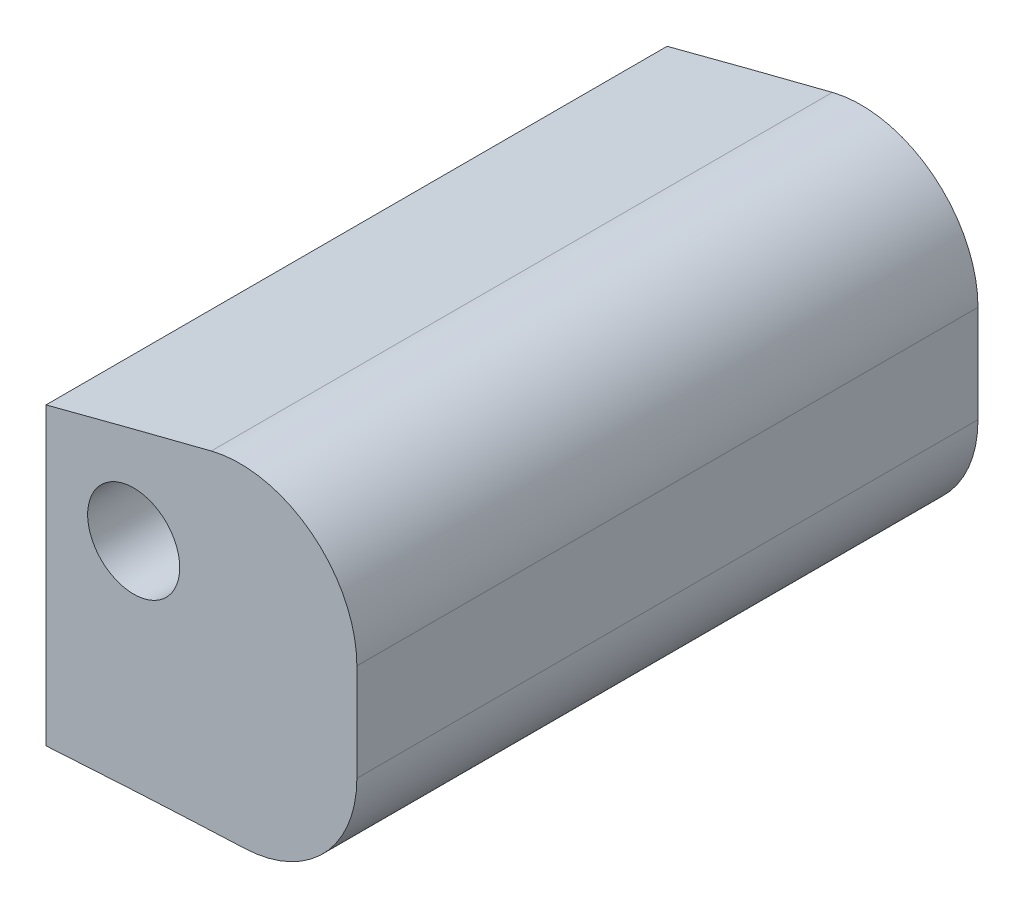
from build123d import *

# Parameters (mm, degrees)
SKETCH1_R           = 2
BOSS_EXTRUDE1_DEPTH = 26.9875
SKETCH2_W           = 86.364255874
SKETCH2_H           = 34.814742066
CUT_EXTRUDE1_DEPTH  = 47.713127442


with BuildPart() as part:
    # Sketch1 → Boss-Extrude1 (new body)
    with BuildSketch(Plane.XY):
        with BuildLine():
            Line((36.087463381, 2.999957931), (36.087463381, 7.227968589))
            ThreePointArc((36.087463381, 7.227968589), (34.127671177, 11.236796761), (29.760414833, 12.152526428))
            add(Edge.make_bspline(
                [(29.760414833, 12.152526428), (20.104550549, 9.70736649), (4.160634919, 5.361227781), (-17.353300331, -1.599332571), (-25.573599276, -4.860049738), (-35.772390435, -8.549078563), (-32.029323662, -8.160268468)],
                knots=[0.330745029, 0.330745029, 0.330745029, 0.330745029, 0.630725311, 0.824213609, 0.940085477, 1, 1, 1, 1], degree=3))
            add(Edge.make_bspline(
                [(-32.029323662, -8.160268468), (-27.594277811, -7.052683566), (-20.08844374, -6.583461174), (-6.740332369, -4.760965275), (4.869732234, -4.072592428), (18.49447741, -2.742713062), (26.204740163, -2.287162162), (31.22157185, -2.075528013)],
                knots=[0, 0, 0, 0, 0.144322392, 0.237947652, 0.42712275, 0.512831912, 0.67202474, 0.67202474, 0.67202474, 0.67202474], degree=3))
            ThreePointArc((31.22157185, -2.075528013), (34.674483358, -0.515630852), (36.087463381, 2.999957931))
        make_face()
        with Locations((26.390676338, 7.079731532)):
            Circle(SKETCH1_R, mode=Mode.SUBTRACT)
    extrude(amount=BOSS_EXTRUDE1_DEPTH)

    # Sketch2 → Cut-Extrude1 (cut, through all)
    with BuildSketch(Plane.XY.offset(26.9875)):
        with Locations((-20.601451599, -3.276083686)):
            Rectangle(SKETCH2_W, SKETCH2_H)
    extrude(amount=-CUT_EXTRUDE1_DEPTH, mode=Mode.SUBTRACT)


solid = part.part
